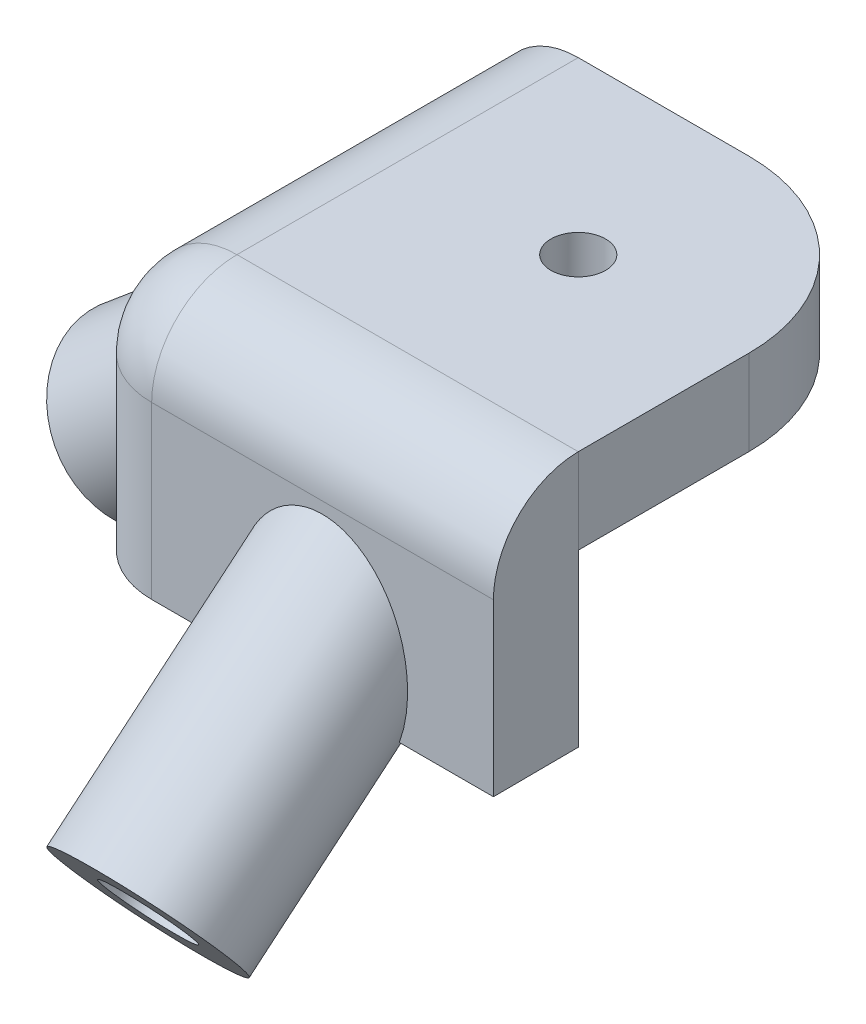
from build123d import *

# Parameters (mm, degrees)
SKETCH_1_W          = 20
SKETCH_1_H          = 20
EXTRUDE_1_DEPTH     = 8
SKETCH_2_R          = 5
EXTRUDE_2_DEPTH     = 25
SKETCH_3_R          = 5
EXTRUDE_3_DEPTH     = 25
SKETCH_4_R          = 1.6
CUT_EXTRUDE_1_DEPTH = 48.126892062
EXTRUDE_4_DEPTH     = 15
CUT_EXTRUDE_START   = -10
CUT_EXTRUDE_5_DEPTH = 10
SKETCH_11_R         = 2.5
CUT_EXTRUDE_6_DEPTH = 10
SKETCH_12_R         = 2.5
CUT_EXTRUDE_7_DEPTH = 10
FILLET_3_R          = 5


with BuildPart() as part:
    # 草圖1 → 填料-伸長1 (new body)
    with BuildSketch(Plane(origin=(0, 0, 0), x_dir=(1, 0, 0), z_dir=(0, 1, 0))):
        Rectangle(SKETCH_1_W, SKETCH_1_H)
    extrude(amount=EXTRUDE_1_DEPTH)

    # 草圖2 → 填料-伸長2 (add)
    with BuildSketch(Plane(origin=(0, -1.618631476, 1.929009876), x_dir=(1, 0, 0), z_dir=(0, -0.6427876096865406, 0.7660444431189771))):
        with Locations((0, 6.427876097)):
            Circle(SKETCH_2_R)
    extrude(amount=EXTRUDE_2_DEPTH)

    # 草圖3 → 填料-伸長3 (add)
    with BuildSketch(Plane(origin=(-1.929009876, -1.618631476, 0), x_dir=(0, 0, 1), z_dir=(-0.7660444431189771, -0.6427876096865406, 0))):
        with Locations((0, 6.427876097)):
            Circle(SKETCH_3_R)
    extrude(amount=EXTRUDE_3_DEPTH)

    # 草圖4 → 除料-伸長1 (cut, through all)
    with BuildSketch(Plane(origin=(0, 8, 0), x_dir=(1, 0, 0), z_dir=(0, 1, 0))):
        Circle(SKETCH_4_R)
        with BuildLine():
            Line((0, 10), (10, 10))
            Line((10, 10), (10, 0))
            ThreePointArc((10, 0), (7.071067812, 7.071067812), (0, 10))
        make_face()
    extrude(amount=-CUT_EXTRUDE_1_DEPTH, mode=Mode.SUBTRACT)

    # 草圖9 → 填料-伸長4 (add)
    with BuildSketch(Plane(origin=(0, 8, 0), x_dir=(1, 0, 0), z_dir=(0, 1, 0))):
        Polygon((-10, 10), (-15, 10), (-15, -15), (10.028553892, -15), (10, -10), (-10, -10), align=None)
    extrude(amount=-EXTRUDE_4_DEPTH)

    # 草圖10 → 除料-伸長5 (cut)
    with BuildSketch(Plane.XZ.offset(7).offset(CUT_EXTRUDE_START)):
        with BuildLine():
            Line((10, 0), (10, 10))
            Line((10, 10), (-10, 10))
            Line((-10, 10), (-10, -10))
            Line((-10, -10), (0, -10))
            ThreePointArc((0, -10), (7.071067812, -7.071067812), (10, 0))
        make_face()
    extrude(amount=CUT_EXTRUDE_5_DEPTH, mode=Mode.SUBTRACT)

    # 草圖11 → 除料-伸長6 (cut)
    with BuildSketch(Plane(origin=(-21.080120954, -17.688321718, 0), x_dir=(0, 0, 1), z_dir=(-0.7660444431189772, -0.6427876096865405, 0))):
        with Locations((0, 6.427876097)):
            Circle(SKETCH_11_R)
    extrude(amount=-CUT_EXTRUDE_6_DEPTH, mode=Mode.SUBTRACT)

    # 草圖12 → 除料-伸長7 (cut)
    with BuildSketch(Plane(origin=(0, -17.688321718, 21.080120954), x_dir=(1, 0, 0), z_dir=(0, -0.6427876096865405, 0.7660444431189771))):
        with Locations((0, 6.427876097)):
            Circle(SKETCH_12_R)
    extrude(amount=-CUT_EXTRUDE_7_DEPTH, mode=Mode.SUBTRACT)

    # 圓角3
    fillet_3_edges = [part.edges().sort_by_distance(p)[0] for p in [
        (-2.485723054, 8, 15),
        (-15, 8, 2.5),
        (-15, 0.5, 15),
    ]]
    fillet(fillet_3_edges, radius=FILLET_3_R)


solid = part.part
